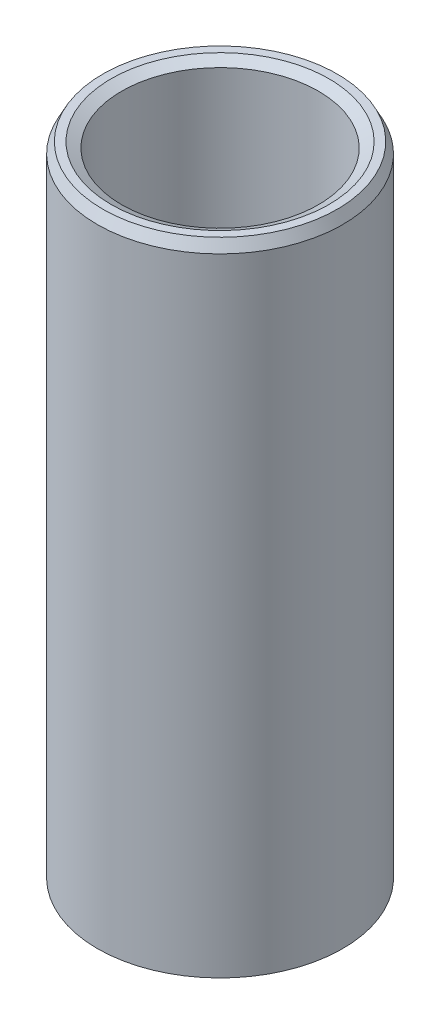
from build123d import *
from OCP.BRepFilletAPI import BRepFilletAPI_MakeChamfer

# Parameters (mm, degrees)
SKETCH1_R           = 32.5
BOSS_EXTRUDE1_DEPTH = 170.396110979
SKETCH2_R           = 26.077068307
CUT_EXTRUDE1_DEPTH  = 177.486074909
CHAMFER1_SIZE       = 2.794964954
CHAMFER1_SIZE2      = 1.44988206


with BuildPart() as part:
    # Sketch1 → Boss-Extrude1 (new body)
    with BuildSketch(Plane(origin=(0, 0, 0), x_dir=(1, 0, 0), z_dir=(0, 1, 0))):
        Circle(SKETCH1_R)
    extrude(amount=BOSS_EXTRUDE1_DEPTH)

    # Sketch2 → Cut-Extrude1 (cut, through all)
    with BuildSketch(Plane(origin=(0, 0, 0), x_dir=(1, 0, 0), z_dir=(0, 1, 0))):
        Circle(SKETCH2_R)
    extrude(amount=CUT_EXTRUDE1_DEPTH, mode=Mode.SUBTRACT)

    # Chamfer1: one chamfer whose edges measure the first distance from different faces: ONE call of the kernel's chamfer builder (chamfer() names one face for all edges)
    chamfer1_edges_1 = [part.edges().sort_by_distance(p)[0] for p in [
        (-26.077068307, 170.396110979, 0),
    ]]
    chamfer1_side_1 = [part.faces().sort_by_distance(p)[0] for p in [
        (-31.580761184, 170.396110979, 0),
    ]]
    chamfer1_edges_2 = [part.edges().sort_by_distance(p)[0] for p in [
        (-26.077068307, 0, 0),
    ]]
    chamfer1_side_2 = [part.faces().sort_by_distance(p)[0] for p in [
        (-26.077068307, 85.19805549, 0),
    ]]
    chamfer1_edges_3 = [part.edges().sort_by_distance(p)[0] for p in [
        (-32.5, 0, 0),
    ]]
    chamfer1_side_3 = [part.faces().sort_by_distance(p)[0] for p in [
        (-31.580761184, 0, 0),
    ]]
    chamfer1_edges_4 = [part.edges().sort_by_distance(p)[0] for p in [
        (-32.5, 170.396110979, 0),
    ]]
    chamfer1_side_4 = [part.faces().sort_by_distance(p)[0] for p in [
        (-32.5, 85.19805549, 0),
    ]]
    chamfer1 = BRepFilletAPI_MakeChamfer(part.part.solid().wrapped)
    for e in chamfer1_edges_1:
        chamfer1.Add(CHAMFER1_SIZE, CHAMFER1_SIZE2, e.wrapped, chamfer1_side_1[0].wrapped)  # the first distance lies on this face
    for e in chamfer1_edges_2:
        chamfer1.Add(CHAMFER1_SIZE, CHAMFER1_SIZE2, e.wrapped, chamfer1_side_2[0].wrapped)  # the first distance lies on this face
    for e in chamfer1_edges_3:
        chamfer1.Add(CHAMFER1_SIZE, CHAMFER1_SIZE2, e.wrapped, chamfer1_side_3[0].wrapped)  # the first distance lies on this face
    for e in chamfer1_edges_4:
        chamfer1.Add(CHAMFER1_SIZE, CHAMFER1_SIZE2, e.wrapped, chamfer1_side_4[0].wrapped)  # the first distance lies on this face
    add(Compound.cast(chamfer1.Shape()), mode=Mode.REPLACE)


solid = part.part
